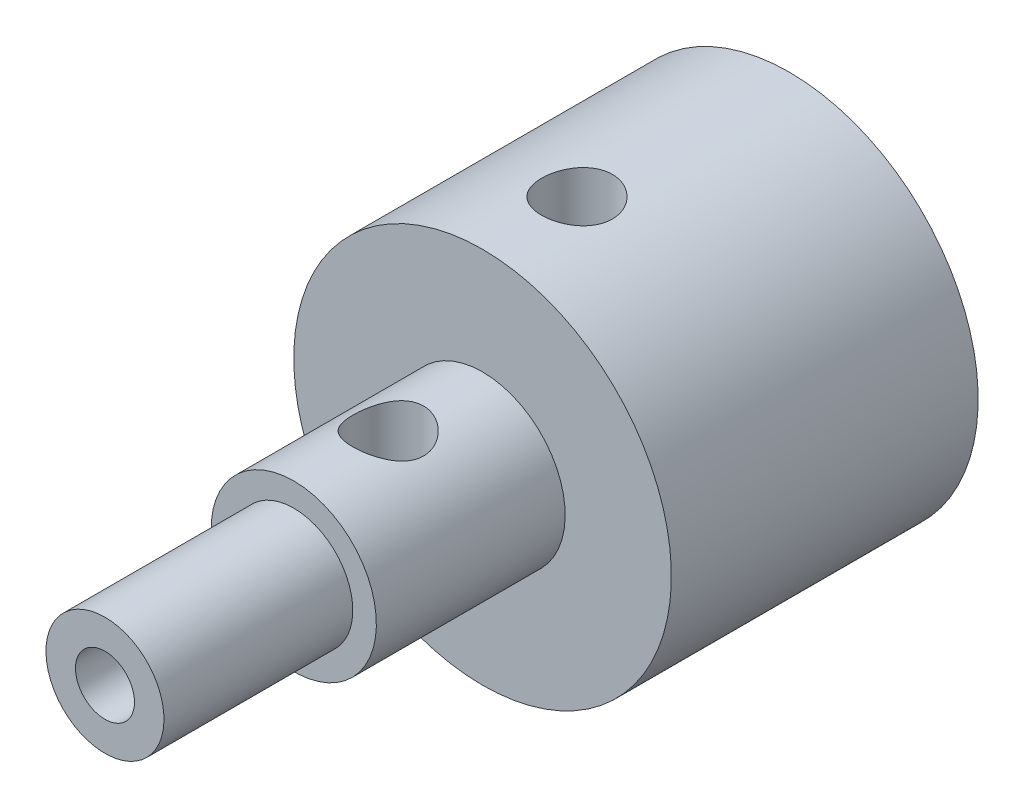
from build123d import *

# Parameters (mm, degrees)
CUT_EXTRUDE1_REACH             = 33.129
SKETCH2_R                      = 1.5
CUT_EXTRUDE1_DIRECTION_2_REACH = 33.129
SKETCH4_R                      = 1.25
CUT_EXTRUDE2_DEPTH             = 10


with BuildPart() as part:
    # Sketch1 → Revolve1 (revolve)
    with BuildSketch(Plane(origin=(0, 0, 0), x_dir=(0, 0, -1), z_dir=(1, 0, 0))):
        Polygon((0, 0), (0, 2.5), (8, 2.5), (8, 3.5), (16, 3.5), (16, 8), (29, 8), (29, 3.2), (18.5, 3.2), (16.577246019, 0), align=None)
    revolve(axis=Axis((0, 0, -16.577246019), (0, 0, 1)))

    # Sketch2 → Cut-Extrude1 (cut, up to next)
    with BuildSketch(Plane(origin=(0, 0, 0), x_dir=(1, 0, 0), z_dir=(0, 1, 0)), mode=Mode.PRIVATE) as cut_extrude1_sk1:
        with Locations((0, 20)):
            Circle(SKETCH2_R)
    cut_extrude1_tool1 = extrude(cut_extrude1_sk1.sketch, amount=-CUT_EXTRUDE1_REACH, mode=Mode.PRIVATE) & part.part
    # Sketch2 → Cut-Extrude1 (cut, up to next)
    with BuildSketch(Plane(origin=(0, 0, 0), x_dir=(1, 0, 0), z_dir=(0, 1, 0)), mode=Mode.PRIVATE) as cut_extrude1_sk2:
        with Locations((0, 12)):
            Circle(SKETCH2_R)
    cut_extrude1_tool2 = extrude(cut_extrude1_sk2.sketch, amount=-CUT_EXTRUDE1_REACH, mode=Mode.PRIVATE) & part.part
    add(cut_extrude1_tool1.solids().sort_by_distance((0, 0, -20))[0], mode=Mode.SUBTRACT)
    add(cut_extrude1_tool2.solids().sort_by_distance((0, 0, -12))[0], mode=Mode.SUBTRACT)

    # Sketch2 → Cut-Extrude1 direction 2 (cut, up to next)
    with BuildSketch(Plane(origin=(0, 0, 0), x_dir=(1, 0, 0), z_dir=(0, 1, 0)), mode=Mode.PRIVATE) as cut_extrude1_direction_2_sk1:
        with Locations((0, 20)):
            Circle(SKETCH2_R)
    cut_extrude1_direction_2_tool1 = extrude(cut_extrude1_direction_2_sk1.sketch, amount=CUT_EXTRUDE1_DIRECTION_2_REACH, mode=Mode.PRIVATE) & part.part
    # Sketch2 → Cut-Extrude1 direction 2 (cut, up to next)
    with BuildSketch(Plane(origin=(0, 0, 0), x_dir=(1, 0, 0), z_dir=(0, 1, 0)), mode=Mode.PRIVATE) as cut_extrude1_direction_2_sk2:
        with Locations((0, 12)):
            Circle(SKETCH2_R)
    cut_extrude1_direction_2_tool2 = extrude(cut_extrude1_direction_2_sk2.sketch, amount=CUT_EXTRUDE1_DIRECTION_2_REACH, mode=Mode.PRIVATE) & part.part
    add(cut_extrude1_direction_2_tool1.solids().sort_by_distance((0, 0, -20))[0], mode=Mode.SUBTRACT)
    add(cut_extrude1_direction_2_tool2.solids().sort_by_distance((0, 0, -12))[0], mode=Mode.SUBTRACT)

    # Sketch4 → Cut-Extrude2 (cut)
    with BuildSketch(Plane.XY):
        Circle(SKETCH4_R)
    extrude(amount=-CUT_EXTRUDE2_DEPTH, mode=Mode.SUBTRACT)


solid = part.part
